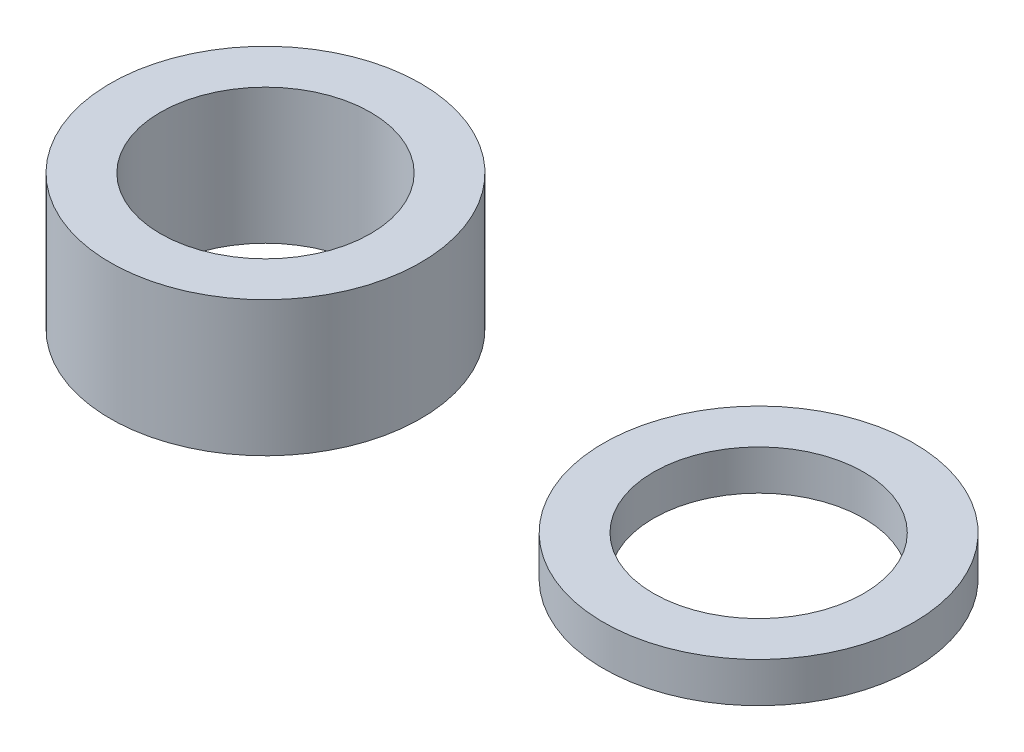
from build123d import *

# Parameters (mm, degrees)
SKETCH1_R           = 6.2
SKETCH1_R_2         = 4.2
EXTRUDE_THIN1_DEPTH = 1.6
SKETCH2_R           = 6.2
SKETCH2_R_2         = 4.2
EXTRUDE_THIN2_DEPTH = 5.4


with BuildPart() as part:
    # Sketch1 → Extrude-Thin1 (new body)
    with BuildSketch(Plane(origin=(0, 0, 0), x_dir=(1, 0, 0), z_dir=(0, 1, 0))):
        Circle(SKETCH1_R)
        Circle(SKETCH1_R_2, mode=Mode.SUBTRACT)
    extrude(amount=EXTRUDE_THIN1_DEPTH)


with BuildPart() as body_2:
    # Sketch2 → Extrude-Thin2 (new body)
    with BuildSketch(Plane(origin=(0, 0, 0), x_dir=(1, 0, 0), z_dir=(0, 1, 0))):
        with Locations((-18.494504598, -1.203466443)):
            Circle(SKETCH2_R)
        with Locations((-18.494504598, -1.203466443)):
            Circle(SKETCH2_R_2, mode=Mode.SUBTRACT)
    extrude(amount=EXTRUDE_THIN2_DEPTH)


solid = Compound([part.part, body_2.part])
